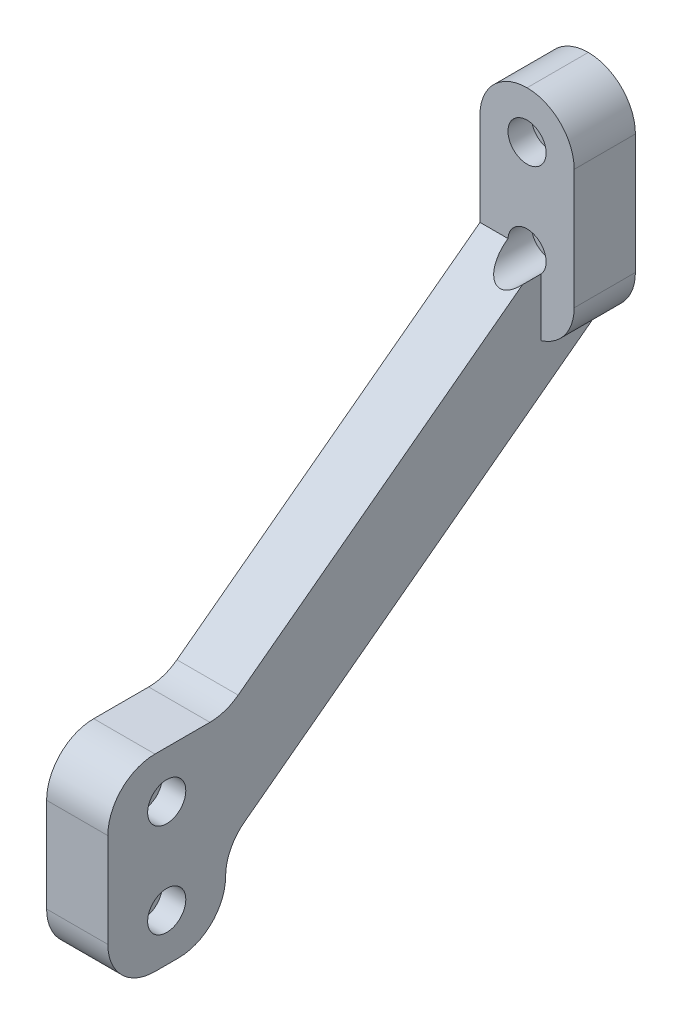
from build123d import *

# Parameters (mm, degrees)
SALIENTE_EXTRUIR1_DEPTH = 13
CROQUIS4_W              = 13
CROQUIS4_H              = 45
SALIENTE_EXTRUIR2_DEPTH = 7
CROQUIS5_R              = 2.125
CORTAR_EXTRUIR1_DEPTH   = 160.981248901
CROQUIS6_R              = 4.05
CORTAR_EXTRUIR2_DEPTH   = 5
CORTAR_EXTRUIR3_REACH   = 162.702
CROQUIS7_R              = 2.125
CORTAR_EXTRUIR4_REACH   = 170.702
CORTAR_EXTRUIR4_START   = -8
CROQUIS8_R              = 4.05
REDONDEO2_R             = 10
REDONDEO5_R             = 10


with BuildPart() as part:
    # Croquis1 → Saliente-Extruir1 (new body)
    with BuildSketch(Plane(origin=(0, 0, 0), x_dir=(0, 0, -1), z_dir=(1, 0, 0))):
        Polygon((0, 0), (0, 40), (25, 40), (92, 90.25), (92, 120), (105, 120), (105, 75), (25, 15), (25, 0), align=None)
    extrude(amount=SALIENTE_EXTRUIR1_DEPTH)

    # Croquis4 → Saliente-Extruir2 (add)
    with BuildSketch(Plane(origin=(13, 0, 0), x_dir=(0, 0, -1), z_dir=(1, 0, 0))):
        with Locations((98.5, 97.5)):
            Rectangle(CROQUIS4_W, CROQUIS4_H)
    extrude(amount=SALIENTE_EXTRUIR2_DEPTH)

    # Croquis5 → Cortar-Extruir1 (cut, through all)
    with BuildSketch(Plane(origin=(13, 0, 0), x_dir=(0, 0, -1), z_dir=(1, 0, 0))):
        with Locations((12.5, 30)):
            Circle(CROQUIS5_R)
        with Locations((12.5, 10)):
            Circle(CROQUIS5_R)
    extrude(amount=-CORTAR_EXTRUIR1_DEPTH, mode=Mode.SUBTRACT)

    # Croquis6 → Cortar-Extruir2 (cut)
    with BuildSketch(Plane(origin=(13, 0, 0), x_dir=(0, 0, -1), z_dir=(1, 0, 0))):
        with Locations((12.5, 30)):
            Circle(CROQUIS6_R)
        with Locations((12.5, 10)):
            Circle(CROQUIS6_R)
    extrude(amount=-CORTAR_EXTRUIR2_DEPTH, mode=Mode.SUBTRACT)

    # Croquis7 → Cortar-Extruir3 (cut, up to next)
    with BuildSketch(Plane(origin=(0, 0, -105), x_dir=(-1, 0, 0), z_dir=(0, 0, -1)), mode=Mode.PRIVATE) as cortar_extruir3_sk1:
        with Locations(Location((-10, 110, 0), (0, 0, 90))):
            Circle(CROQUIS7_R)
    cortar_extruir3_tool1 = extrude(cortar_extruir3_sk1.sketch, amount=-CORTAR_EXTRUIR3_REACH, mode=Mode.PRIVATE) & part.part
    # Croquis7 → Cortar-Extruir3 (cut, up to next)
    with BuildSketch(Plane(origin=(0, 0, -105), x_dir=(-1, 0, 0), z_dir=(0, 0, -1)), mode=Mode.PRIVATE) as cortar_extruir3_sk2:
        with Locations(Location((-10, 90, 0), (0, 0, 90))):
            Circle(CROQUIS7_R)
    cortar_extruir3_tool2 = extrude(cortar_extruir3_sk2.sketch, amount=-CORTAR_EXTRUIR3_REACH, mode=Mode.PRIVATE) & part.part
    add(cortar_extruir3_tool1.solids().sort_by_distance((10, 110, -105))[0], mode=Mode.SUBTRACT)
    add(cortar_extruir3_tool2.solids().sort_by_distance((10, 90, -105))[0], mode=Mode.SUBTRACT)

    # Croquis8 → Cortar-Extruir4 (cut, up to next)
    with BuildSketch(Plane(origin=(0, 0, -105), x_dir=(-1, 0, 0), z_dir=(0, 0, -1)).offset(CORTAR_EXTRUIR4_START), mode=Mode.PRIVATE) as cortar_extruir4_sk1:
        with Locations(Location((-10, 110, 0), (0, 0, 90))):
            Circle(CROQUIS8_R)
    cortar_extruir4_tool1 = extrude(cortar_extruir4_sk1.sketch, amount=-CORTAR_EXTRUIR4_REACH, mode=Mode.PRIVATE) & part.part
    # Croquis8 → Cortar-Extruir4 (cut, up to next)
    with BuildSketch(Plane(origin=(0, 0, -105), x_dir=(-1, 0, 0), z_dir=(0, 0, -1)).offset(CORTAR_EXTRUIR4_START), mode=Mode.PRIVATE) as cortar_extruir4_sk2:
        with Locations(Location((-10, 90, 0), (0, 0, 90))):
            Circle(CROQUIS8_R)
    cortar_extruir4_tool2 = extrude(cortar_extruir4_sk2.sketch, amount=-CORTAR_EXTRUIR4_REACH, mode=Mode.PRIVATE) & part.part
    add(cortar_extruir4_tool1.solids().sort_by_distance((10, 110, -97))[0], mode=Mode.SUBTRACT)
    add(cortar_extruir4_tool2.solids().sort_by_distance((10, 90, -97))[0], mode=Mode.SUBTRACT)

    # Redondeo2
    redondeo2_edges = [part.edges().sort_by_distance(p)[0] for p in [
        (6.5, 15, -25),
    ]]
    fillet(redondeo2_edges, radius=REDONDEO2_R)

    # Redondeo5
    # the kernel refuses this fillet: 10 mm, written as the material it adds along each edge
    with BuildSketch(Plane(origin=(0, 40, -25), x_dir=(0, 0, 1), z_dir=(1, 0, 0))) as redondeo5_piece_1:
        with BuildLine():
            CenterArc((REDONDEO5_R * 0.333333333333, -REDONDEO5_R), REDONDEO5_R, 90, 36.869897646)
            Line((-REDONDEO5_R * 0.266666666667, -REDONDEO5_R * 0.2), (0, 0))
            Line((0, 0), (REDONDEO5_R * 0.333333333333, 0))
        make_face()
    extrude(amount=13)
    # the kernel refuses this fillet: 10 mm, written as the material it takes off along each edge
    with BuildSketch(Plane(origin=(-25, 0, 0), x_dir=(0, 0, -1), z_dir=(1, 0, 0)), Plane(origin=(-25, 0, -25), x_dir=(0, 1, 0), z_dir=(1, 0, 0)), Plane(origin=(-25, 40, 0), x_dir=(0, -1, 0), z_dir=(1, 0, 0)), Plane(origin=(20, 120, -130), x_dir=(-1, 0, 0), z_dir=(0, 0, 1))) as redondeo5_2_piece_1:
        with BuildLine():
            CenterArc((REDONDEO5_R, REDONDEO5_R), REDONDEO5_R, 180, 90)
            Line((0, REDONDEO5_R), (0, 0))
            Line((0, 0), (REDONDEO5_R, 0))
        make_face()
    extrude(amount=63, mode=Mode.SUBTRACT)
    with BuildSketch(Plane(origin=(20, 75, -68.151519965), x_dir=(0, 1, 0), z_dir=(0, 0, -1))) as redondeo5_2_piece_2:
        with BuildLine():
            CenterArc((9.539392014, -10), REDONDEO5_R, 90, 72.542396876)
            Line((0, -7), (0, 0))
            Line((0, 0), (9.539392014, 0))
        make_face()
    extrude(amount=60.696960071, mode=Mode.SUBTRACT)
    with BuildSketch(Plane(origin=(0, 120, -67), x_dir=(0, -1, 0), z_dir=(0, 0, -1))) as redondeo5_2_piece_3:
        with BuildLine():
            CenterArc((REDONDEO5_R, -REDONDEO5_R), REDONDEO5_R, 90, 90)
            Line((0, -REDONDEO5_R), (0, 0))
            Line((0, 0), (REDONDEO5_R, 0))
        make_face()
    extrude(amount=63, mode=Mode.SUBTRACT)


solid = part.part
